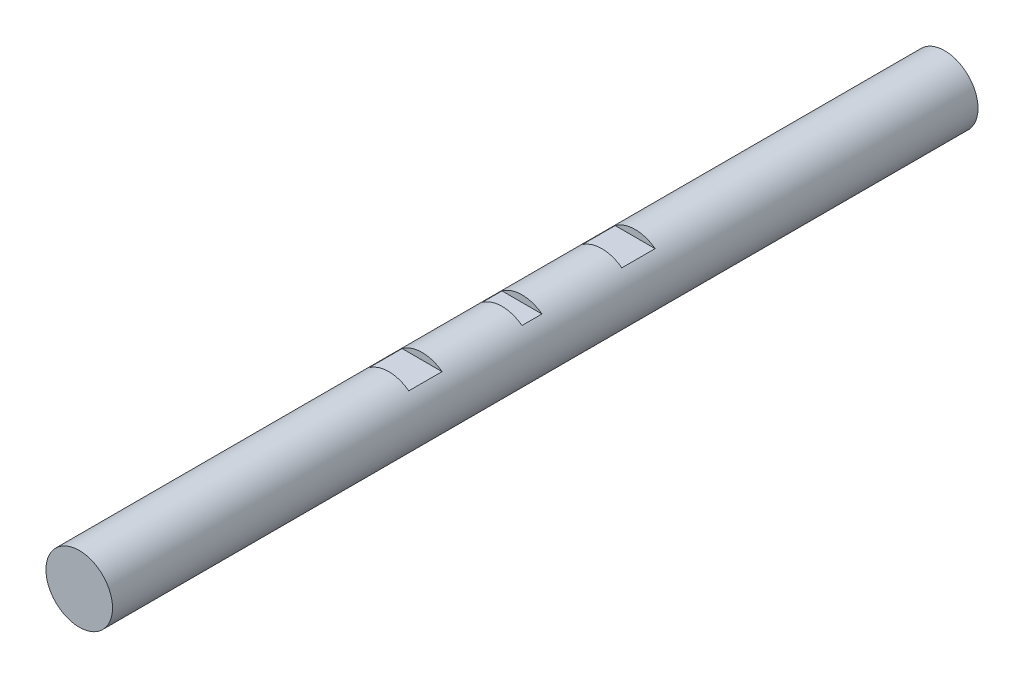
from build123d import *

# Parameters (mm, degrees)
BOSS_EXTRUDE1_DEPTH      = 65
BOSS_EXTRUDE1_DEPTH_BACK = 65
SKETCH1_R                = 5
CUT_EXTRUDE1_DEPTH       = 66.383484153
CUT_EXTRUDE1_DEPTH_BACK  = 66.383484153
SKETCH3_W                = 5
SKETCH3_H                = 1
SKETCH3_W_2              = 3


with BuildPart() as part:
    # Sketch1 → Boss-Extrude1 (new, two sides: drawn at the far end of the back side and taken through both)
    with BuildSketch(Plane.XY.offset(-BOSS_EXTRUDE1_DEPTH_BACK)):
        Circle(SKETCH1_R)
    extrude(amount=BOSS_EXTRUDE1_DEPTH + BOSS_EXTRUDE1_DEPTH_BACK)

    # Sketch3 → Cut-Extrude1 (cut, two sides: drawn at the far end of the back side and taken through both)
    with BuildSketch(Plane(origin=(0, 0, 0), x_dir=(0, 0, -1), z_dir=(1, 0, 0)).offset(-CUT_EXTRUDE1_DEPTH_BACK)):
        with Locations((16, 4.5)):
            Rectangle(SKETCH3_W, SKETCH3_H)
        with Locations((-16, 4.5)):
            Rectangle(SKETCH3_W, SKETCH3_H)
        with Locations((0, 4.5)):
            Rectangle(SKETCH3_W_2, SKETCH3_H)
    extrude(amount=CUT_EXTRUDE1_DEPTH + CUT_EXTRUDE1_DEPTH_BACK, mode=Mode.SUBTRACT)


solid = part.part
